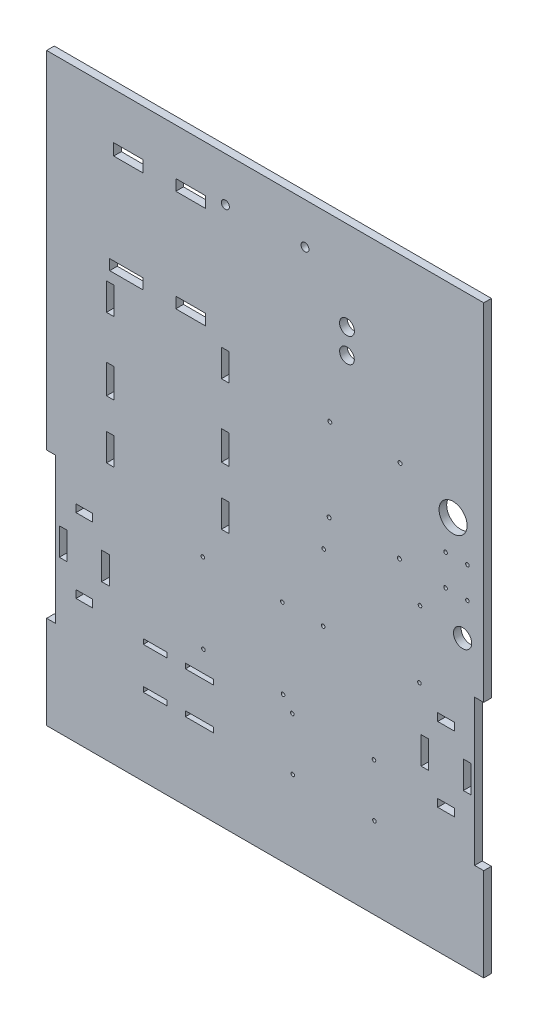
from build123d import *

# Parameters (mm, degrees)
SKETCH1_W                = 304.8
SKETCH1_H                = 304.8
BOSS_EXTRUDE1_DEPTH      = 5.334
SKETCH2_W                = 6.35
SKETCH2_H                = 101.6
CUT_EXTRUDE1_DEPTH       = 216.592141684
SKETCH26_W               = 11.599333334
SKETCH26_H               = 5.334
SKETCH26_W_2             = 5.334
SKETCH26_H_2             = 19.05
CUT_EXTRUDE11_DEPTH      = 216.592141684
SKETCH27_W               = 11.599333334
SKETCH27_H               = 5.334
SKETCH27_W_2             = 5.334
SKETCH27_H_2             = 19.05
CUT_EXTRUDE12_DEPTH      = 216.592141684
SKETCH29_W               = 304.8
SKETCH29_H               = 24.084758951
CUT_EXTRUDE13_DEPTH      = 216.592141684
SKETCH31_R               = 1.374999997
CUT_EXTRUDE15_DEPTH      = 216.592141684
SKETCH32_R               = 1.25
CUT_EXTRUDE16_DEPTH      = 216.592141684
SKETCH34_R               = 1.249249953
SKETCH34_R_2             = 1.249999995
SKETCH34_R_3             = 1.252496274
SKETCH34_R_4             = 1.251959019
CUT_EXTRUDE18_DEPTH      = 216.592141684
SKETCH38_R               = 1.248199844
SKETCH38_R_2             = 1.253619174
SKETCH38_R_3             = 1.25252158
SKETCH38_R_4             = 1.237868742
CUT_EXTRUDE22_DEPTH      = 216.592141684
SKETCH40_W               = 304.8
SKETCH40_H               = 5.334
BOSS_EXTRUDE2_DEPTH      = 76.2
SKETCH41_R               = 2.778125
CUT_EXTRUDE24_DEPTH      = 275.794780802
CUT_EXTRUDE25_DEPTH      = 275.794780802
CUT_EXTRUDE25_DEPTH_BACK = 275.794780802
SKETCH42_R               = 1.246523933
SKETCH42_R_2             = 1.251934436
SKETCH42_R_3             = 1.248703554
SKETCH42_R_4             = 1.245581387
SKETCH44_W               = 16.476980096
SKETCH44_H               = 3.5
SKETCH44_W_2             = 19.633145944
SKETCH44_H_2             = 3.596708667
CUT_EXTRUDE27_DEPTH      = 275.794780802
SKETCH45_W               = 20.354162164
SKETCH45_H               = 8.066046326
SKETCH45_W_2             = 20.554982424
SKETCH45_H_2             = 7.688212904
SKETCH45_H_3             = 7.652166289
SKETCH45_W_3             = 23.136298987
SKETCH45_H_4             = 7.272580335
CUT_EXTRUDE28_DEPTH      = 275.794780802
SKETCH46_W               = 304.8
SKETCH46_H               = 5.334
BOSS_EXTRUDE3_DEPTH      = 50.8
SKETCH47_R               = 9.778477959
SKETCH47_R_2             = 6.35205685
CUT_EXTRUDE29_DEPTH      = 275.794780802
SKETCH49_W               = 5.334
SKETCH49_H               = 19.05
SKETCH49_H_2             = 20.295839927
CUT_EXTRUDE30_DEPTH      = 275.794780802
SKETCH52_R               = 5.113702669
SKETCH52_R_2             = 5.177907844
CUT_EXTRUDE33_DEPTH      = 275.794780802


with BuildPart() as part:
    # Sketch1 → Boss-Extrude1 (new body)
    with BuildSketch(Plane.XY):
        Rectangle(SKETCH1_W, SKETCH1_H)
    extrude(amount=BOSS_EXTRUDE1_DEPTH)

    # Sketch2 → Cut-Extrude1 (cut, through all)
    with BuildSketch(Plane(origin=(0, 0, 0), x_dir=(-1, 0, 0), z_dir=(0, 0, -1))):
        with Locations((149.225, -63.5)):
            Rectangle(SKETCH2_W, SKETCH2_H)
        with Locations((-149.225, -63.5)):
            Rectangle(SKETCH2_W, SKETCH2_H)
    extrude(amount=-CUT_EXTRUDE1_DEPTH, mode=Mode.SUBTRACT)

    # Sketch26 → Cut-Extrude11 (cut, through all)
    with BuildSketch(Plane.XY.offset(5.334)):
        with Locations((-126.111, -89.408)):
            Rectangle(SKETCH26_W, SKETCH26_H)
        with Locations((-111.379, -63.5)):
            Rectangle(SKETCH26_W_2, SKETCH26_H_2)
        with Locations((-126.111, -37.592)):
            Rectangle(SKETCH26_W, SKETCH26_H)
        with Locations((-140.843, -63.5)):
            Rectangle(SKETCH26_W_2, SKETCH26_H_2)
    extrude(amount=-CUT_EXTRUDE11_DEPTH, mode=Mode.SUBTRACT)

    # Sketch27 → Cut-Extrude12 (cut, through all)
    with BuildSketch(Plane.XY.offset(5.334)):
        with Locations((126.111, -89.408)):
            Rectangle(SKETCH27_W, SKETCH27_H)
        with Locations((111.379, -63.5)):
            Rectangle(SKETCH27_W_2, SKETCH27_H_2)
        with Locations((126.111, -37.592)):
            Rectangle(SKETCH27_W, SKETCH27_H)
        with Locations((140.843, -63.5)):
            Rectangle(SKETCH27_W_2, SKETCH27_H_2)
    extrude(amount=-CUT_EXTRUDE12_DEPTH, mode=Mode.SUBTRACT)

    # Sketch29 → Cut-Extrude13 (cut, through all)
    with BuildSketch(Plane(origin=(0, 0, 0), x_dir=(-1, 0, 0), z_dir=(0, 0, -1))):
        with Locations((0, -140.357620525)):
            Rectangle(SKETCH29_W, SKETCH29_H)
    extrude(amount=-CUT_EXTRUDE13_DEPTH, mode=Mode.SUBTRACT)

    # Sketch31 → Cut-Extrude15 (cut, through all)
    with BuildSketch(Plane(origin=(0, 0, 0), x_dir=(-1, 0, 0), z_dir=(0, 0, -1))):
        with Locations((-94.072328828, 102.688814533)):
            Circle(SKETCH31_R)
        with Locations((-45.074194598, 103.116414773)):
            Circle(SKETCH31_R)
        with Locations((-93.566189769, 44.691022995)):
            Circle(SKETCH31_R)
        with Locations((-44.568055539, 45.118623235)):
            Circle(SKETCH31_R)
    extrude(amount=-CUT_EXTRUDE15_DEPTH, mode=Mode.SUBTRACT)

    # Sketch32 → Cut-Extrude16 (cut, through all)
    with BuildSketch(Plane(origin=(0, 0, 0), x_dir=(-1, 0, 0), z_dir=(0, 0, -1))):
        with Locations((-125.781887437, 64.718548335)):
            Circle(SKETCH32_R)
        with Locations((-141.021887437, 64.718548335)):
            Circle(SKETCH32_R)
        with Locations((-141.021887437, 43.128548335)):
            Circle(SKETCH32_R)
        with Locations((-125.781887437, 43.128548335)):
            Circle(SKETCH32_R)
    extrude(amount=-CUT_EXTRUDE16_DEPTH, mode=Mode.SUBTRACT)

    # Sketch34 → Cut-Extrude18 (cut, through all)
    with BuildSketch(Plane(origin=(0, 0, 0), x_dir=(-1, 0, 0), z_dir=(0, 0, -1))):
        with Locations((-75.859031626, -85.661481109)):
            Circle(SKETCH34_R)
        with Locations((-76.178771886, -122.30008597)):
            Circle(SKETCH34_R_2)
        with Locations((-19.220652784, -122.797151945)):
            Circle(SKETCH34_R_3)
        with Locations((-18.900912524, -86.158547084)):
            Circle(SKETCH34_R_4)
    extrude(amount=-CUT_EXTRUDE18_DEPTH, mode=Mode.SUBTRACT)

    # Sketch38 → Cut-Extrude22 (cut, through all)
    with BuildSketch(Plane(origin=(0, 0, 0), x_dir=(-1, 0, 0), z_dir=(0, 0, -1))):
        with Locations((43.524965306, -22.819488401)):
            Circle(SKETCH38_R)
        with Locations((-11.972921424, -22.335165681)):
            Circle(SKETCH38_R_2)
        with Locations((-12.457244144, -77.833052411)):
            Circle(SKETCH38_R_3)
        with Locations((43.040642586, -78.317375131)):
            Circle(SKETCH38_R_4)
    extrude(amount=-CUT_EXTRUDE22_DEPTH, mode=Mode.SUBTRACT)

    # Sketch40 → Boss-Extrude2 (add)
    with BuildSketch(Plane(origin=(0, 152.4, 0), x_dir=(1, 0, 0), z_dir=(0, 1, 0))):
        with Locations((0, -2.667)):
            Rectangle(SKETCH40_W, SKETCH40_H)
    extrude(amount=BOSS_EXTRUDE2_DEPTH)

    # Sketch41 → Cut-Extrude24 (cut, through all)
    with BuildSketch(Plane(origin=(0, 0, 0), x_dir=(-1, 0, 0), z_dir=(0, 0, -1))):
        with Locations((-27.760706508, 199.901266021)):
            Circle(SKETCH41_R)
        with Locations((27.760706508, 197.764889883)):
            Circle(SKETCH41_R)
    extrude(amount=-CUT_EXTRUDE24_DEPTH, mode=Mode.SUBTRACT)

    # Sketch42 → Cut-Extrude25 (cut, two sides: drawn at the far end of the back side and taken through both)
    with BuildSketch(Plane(origin=(0, 0, 0), x_dir=(-1, 0, 0), z_dir=(0, 0, -1)).offset(-CUT_EXTRUDE25_DEPTH_BACK)):
        with Locations((-40.428890621, -22.652536652)):
            Circle(SKETCH42_R)
        with Locations((-107.546334897, -23.238261715)):
            Circle(SKETCH42_R_2)
        with Locations((-107.954736759, 23.559956285)):
            Circle(SKETCH42_R_3)
        with Locations((-40.837292483, 24.145681347)):
            Circle(SKETCH42_R_4)
    extrude(amount=CUT_EXTRUDE25_DEPTH + CUT_EXTRUDE25_DEPTH_BACK, mode=Mode.SUBTRACT)

    # Sketch44 → Cut-Extrude27 (cut, through all)
    with BuildSketch(Plane(origin=(0, 0, 0), x_dir=(-1, 0, 0), z_dir=(0, 0, -1))):
        with Locations((76.712846496, -123.491430997)):
            Rectangle(SKETCH44_W, SKETCH44_H)
        with Locations((76.712846496, -94.591430997)):
            Rectangle(SKETCH44_W, SKETCH44_H)
        with Locations((45.782293013, -123.539785331)):
            Rectangle(SKETCH44_W_2, SKETCH44_H_2)
        with Locations((45.782293013, -94.688139664)):
            Rectangle(SKETCH44_W_2, SKETCH44_H)
    extrude(amount=-CUT_EXTRUDE27_DEPTH, mode=Mode.SUBTRACT)

    # Sketch45 → Cut-Extrude28 (cut, through all)
    with BuildSketch(Plane(origin=(0, 0, 0), x_dir=(-1, 0, 0), z_dir=(0, 0, -1))):
        with Locations((95.443302682, 192.238942395)):
            Rectangle(SKETCH45_W, SKETCH45_H)
        with Locations((52.047470718, 192.427859106)):
            Rectangle(SKETCH45_W_2, SKETCH45_H_2)
        with Locations((52.047470716, 121.434632147)):
            Rectangle(SKETCH45_W_2, SKETCH45_H_3)
        with Locations((96.834371094, 121.24483917)):
            Rectangle(SKETCH45_W_3, SKETCH45_H_4)
    extrude(amount=-CUT_EXTRUDE28_DEPTH, mode=Mode.SUBTRACT)

    # Sketch46 → Boss-Extrude3 (add)
    with BuildSketch(Plane.XZ.offset(128.315241049)):
        with Locations((0, 2.667)):
            Rectangle(SKETCH46_W, SKETCH46_H)
    extrude(amount=BOSS_EXTRUDE3_DEPTH)

    # Sketch47 → Cut-Extrude29 (cut, through all)
    with BuildSketch(Plane(origin=(0, 0, 0), x_dir=(-1, 0, 0), z_dir=(0, 0, -1))):
        with Locations((-131.017495066, 88.21224972)):
            Circle(SKETCH47_R)
        with Locations((-137.650958824, 18.755982137)):
            Circle(SKETCH47_R_2)
    extrude(amount=-CUT_EXTRUDE29_DEPTH, mode=Mode.SUBTRACT)

    # Sketch49 → Cut-Extrude30 (cut, through all)
    with BuildSketch(Plane.XY.offset(5.334)):
        with Locations((-27.846255785, 9.907194542)):
            Rectangle(SKETCH49_W, SKETCH49_H)
        with Locations((-107.982405159, 9.907194542)):
            Rectangle(SKETCH49_W, SKETCH49_H)
        with Locations((-107.982405159, 51.068016377)):
            Rectangle(SKETCH49_W, SKETCH49_H_2)
        with Locations((-107.982405159, 100.839194542)):
            Rectangle(SKETCH49_W, SKETCH49_H)
        with Locations((-27.846255785, 100.839194542)):
            Rectangle(SKETCH49_W, SKETCH49_H)
        with Locations((-27.846255785, 51.068016377)):
            Rectangle(SKETCH49_W, SKETCH49_H_2)
    extrude(amount=-CUT_EXTRUDE30_DEPTH, mode=Mode.SUBTRACT)

    # Sketch52 → Cut-Extrude33 (cut, through all)
    with BuildSketch(Plane(origin=(0, 0, 0), x_dir=(-1, 0, 0), z_dir=(0, 0, -1))):
        with Locations((-57.021451744, 149.159143491)):
            Circle(SKETCH52_R)
        with Locations((-57.021451744, 166.299522531)):
            Circle(SKETCH52_R_2)
    extrude(amount=-CUT_EXTRUDE33_DEPTH, mode=Mode.SUBTRACT)


solid = part.part
